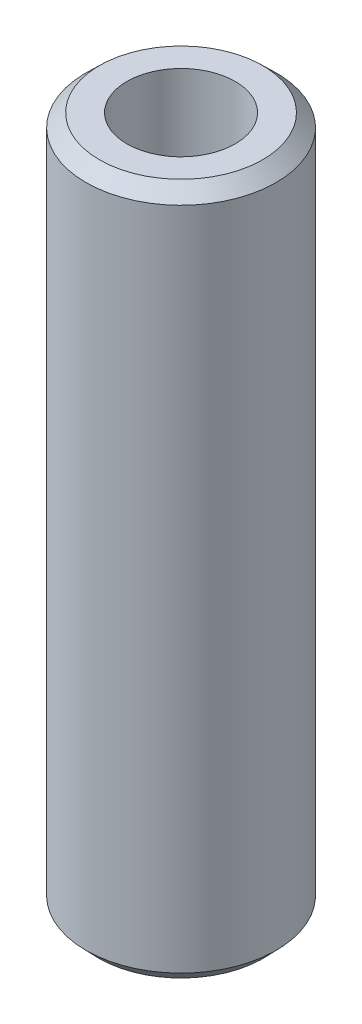
from build123d import *
from OCP.BRepFilletAPI import BRepFilletAPI_MakeChamfer

# Parameters (mm, degrees)
SKETCH1_R           = 27.5
BOSS_EXTRUDE1_DEPTH = 199.963210175
SKETCH2_R           = 15.655743981
CUT_EXTRUDE1_DEPTH  = 204.710052338
CHAMFER1_SIZE       = 3.761198961
CHAMFER1_SIZE2      = 3.890619249


with BuildPart() as part:
    # Sketch1 → Boss-Extrude1 (new body)
    with BuildSketch(Plane(origin=(0, 0, 0), x_dir=(1, 0, 0), z_dir=(0, 1, 0))):
        Circle(SKETCH1_R)
    extrude(amount=BOSS_EXTRUDE1_DEPTH)

    # Sketch2 → Cut-Extrude1 (cut, through all)
    with BuildSketch(Plane(origin=(0, 0, 0), x_dir=(1, 0, 0), z_dir=(0, 1, 0))):
        Circle(SKETCH2_R)
    extrude(amount=CUT_EXTRUDE1_DEPTH, mode=Mode.SUBTRACT)

    # Chamfer1: one chamfer whose edges measure the first distance from different faces: ONE call of the kernel's chamfer builder (chamfer() names one face for all edges)
    chamfer1_edges_1 = [part.edges().sort_by_distance(p)[0] for p in [
        (-27.5, 199.963210175, 0),
    ]]
    chamfer1_side_1 = [part.faces().sort_by_distance(p)[0] for p in [
        (-27.5, 99.981605087, 0),
    ]]
    chamfer1_edges_2 = [part.edges().sort_by_distance(p)[0] for p in [
        (-27.5, 0, 0),
    ]]
    chamfer1_side_2 = [part.faces().sort_by_distance(p)[0] for p in [
        (-26.722182541, 0, 0),
    ]]
    chamfer1 = BRepFilletAPI_MakeChamfer(part.part.solid().wrapped)
    for e in chamfer1_edges_1:
        chamfer1.Add(CHAMFER1_SIZE, CHAMFER1_SIZE2, e.wrapped, chamfer1_side_1[0].wrapped)  # the first distance lies on this face
    for e in chamfer1_edges_2:
        chamfer1.Add(CHAMFER1_SIZE, CHAMFER1_SIZE2, e.wrapped, chamfer1_side_2[0].wrapped)  # the first distance lies on this face
    add(Compound.cast(chamfer1.Shape()), mode=Mode.REPLACE)


solid = part.part
